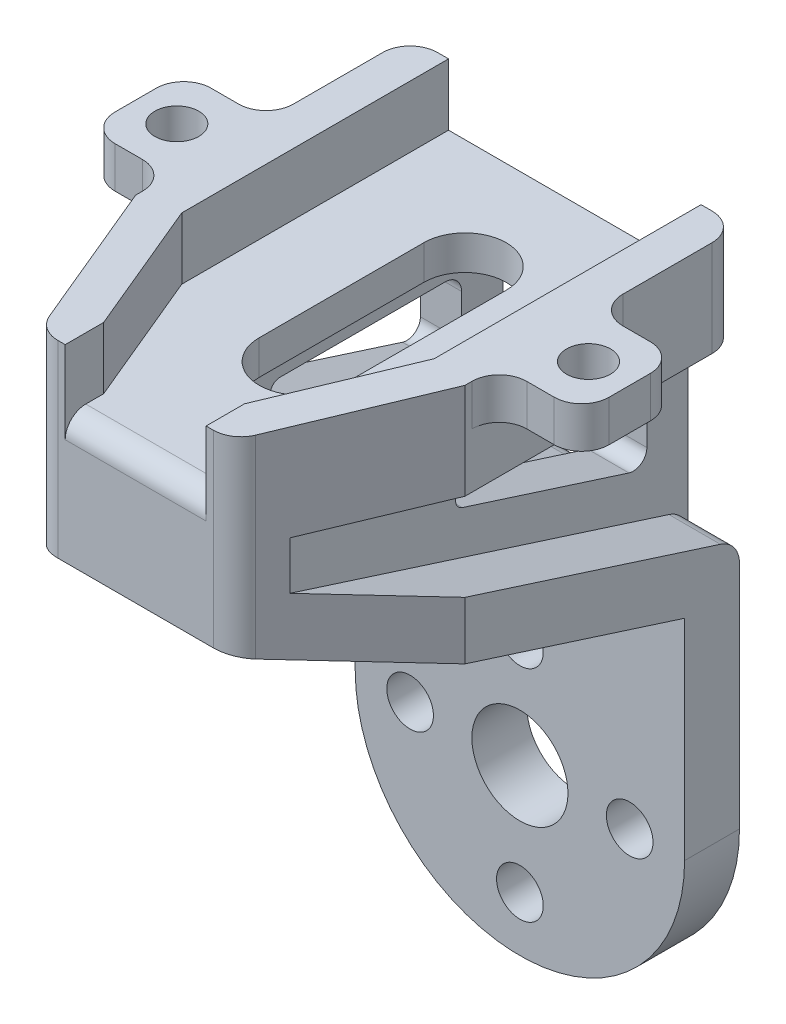
from build123d import *

# Parameters (mm, degrees)
EXTRUDE_1_DEPTH      = 3
SKETCH_7_R           = 1.75
SKETCH_7_R_2         = 2.25
CUT_EXTRUDE_2_DEPTH  = 143.955430949
CUT_EXTRUDE_4_DEPTH  = 3
CUT_EXTRUDE_5_DEPTH  = 3
CUT_EXTRUDE_8_DEPTH  = 3
SKETCH_12_R          = 1.7
CUT_EXTRUDE_9_DEPTH  = 3
SKETCH_13_R          = 1.7
CUT_EXTRUDE_11_DEPTH = 3
CUT_EXTRUDE_12_DEPTH = 143.955430949
FILLET_1_R           = 2
FILLET_2_R           = 2
CUT_EXTRUDE_13_DEPTH = 143.955430949
CUT_EXTRUDE_15_DEPTH = 143.955430949
CUT_EXTRUDE_16_DEPTH = 143.955430949
SKETCH_20_W          = 133.80338819
SKETCH_20_H          = 42.989432067
EXTRUDE_2_DEPTH      = 3
SKETCH_21_W          = 129.207272524
SKETCH_21_H          = 38.788932745
EXTRUDE_3_DEPTH      = 3
SKETCH_22_W          = 20.868569364
SKETCH_22_H          = 31.210515244
SKETCH_22_W_2        = 21.053246969
SKETCH_22_H_2        = 30.102449614
EXTRUDE_4_DEPTH      = 3
SKETCH_24_W          = 36.300662223
SKETCH_24_H          = 5.953308604
SKETCH_24_W_2        = 36.591067521
EXTRUDE_5_DEPTH      = 3
CUT_EXTRUDE_17_DEPTH = 143.955430949
CUT_EXTRUDE_19_DEPTH = 143.955430949
CUT_EXTRUDE_20_DEPTH = 143.955430949
CUT_EXTRUDE_21_DEPTH = 143.955430949
CUT_EXTRUDE_22_DEPTH = 143.955430949
CUT_EXTRUDE_23_DEPTH = 3
SKETCH_30_R          = 1.7
SKETCH_30_R_2        = 3.5
EXTRUDE_6_DEPTH      = 4
EXTRUDE_7_DEPTH      = 24
CUT_EXTRUDE_26_DEPTH = 31.5
EXTRUDE_8_DEPTH      = 10
EXTRUDE_9_DEPTH      = 1
CUT_EXTRUDE_27_DEPTH = 10
SKETCH_38_W          = 3
SKETCH_38_H          = 1
CUT_EXTRUDE_28_DEPTH = 166.273761152
CUT_EXTRUDE_29_DEPTH = 21
EXTRUDE_11_DEPTH     = 7
CUT_EXTRUDE_30_DEPTH = 5.5
EXTRUDE_12_DEPTH     = 3
CUT_EXTRUDE_31_DEPTH = 23
FILLET_4_R           = 0.7
FILLET_5_R           = 1
FILLET_6_R           = 1.2
CUT_EXTRUDE_32_DEPTH = 3
SKETCH_47_W          = 24
SKETCH_47_H          = 1
CUT_EXTRUDE_33_DEPTH = 167.672697425
SKETCH_48_W          = 6
SKETCH_48_H          = 7
SKETCH_48_R          = 1.6
EXTRUDE_13_DEPTH     = 3
FILLET_7_R           = 2
SKETCH_49_W          = 40.518885993
SKETCH_49_H          = 45.885701136
CUT_EXTRUDE_34_DEPTH = 33
FILLET_8_R           = 2
FILLET_9_R           = 2
FILLET_10_R          = 2
FILLET_11_R          = 2
FILLET_12_R          = 1.5
FILLET_13_R          = 1.5
SKETCH_51_W          = 39.862092077
SKETCH_51_H          = 12.943026848
CUT_EXTRUDE_36_DEPTH = 40


# Read off the part's stored shape, not the designer's step: 切除-拉伸35
with BuildPart() as part:
    # 草图1 → 凸台-拉伸1 (new body)
    # profile 1 of 14: a face of its own
    with BuildSketch(Plane.XY):
        with BuildLine():
            Line((60, 106.603296002), (35.889163634, 121.664519159))
            Line((35.889163634, 121.664519159), (-35.889163634, 121.664519159))
            Line((-35.889163634, 121.664519159), (-60, 106.603296002))
            Line((-60, 106.603296002), (-60, 94.801892265))
            Line((-60, 94.801892265), (-45, 94.801892265))
            ThreePointArc((-45, 94.801892265), (-43.762563133, 94.289329132), (-43.25, 93.051892265))
            Line((-43.25, 93.051892265), (-37.75, 93.051892265))
            ThreePointArc((-37.75, 93.051892265), (-37.237436867, 94.289329132), (-36, 94.801892265))
            Line((-36, 94.801892265), (-21, 94.801892265))
            ThreePointArc((-21, 94.801892265), (-19.762563133, 94.289329132), (-19.25, 93.051892265))
            Line((-19.25, 93.051892265), (19.25, 93.051892265))
            ThreePointArc((19.25, 93.051892265), (19.762563133, 94.289329132), (21, 94.801892265))
            Line((21, 94.801892265), (36, 94.801892265))
            ThreePointArc((36, 94.801892265), (37.237436867, 94.289329132), (37.75, 93.051892265))
            Line((37.75, 93.051892265), (43.25, 93.051892265))
            ThreePointArc((43.25, 93.051892265), (43.762563133, 94.289329132), (45, 94.801892265))
            Line((45, 94.801892265), (60, 94.801892265))
            Line((60, 94.801892265), (60, 106.603296002))
        make_face()
    # profile 2 of 14: a face of its own
    with BuildSketch(Plane.XY):
        with BuildLine():
            Line((66.901694095, 102.292041372), (60, 106.603296002))
            Line((60, 106.603296002), (60, 94.801892265))
            ThreePointArc((60, 94.801892265), (61.237436867, 94.289329132), (61.75, 93.051892265))
            Line((61.75, 93.051892265), (66.901694095, 93.051892265))
            Line((66.901694095, 93.051892265), (66.901694095, 102.292041372))
        make_face()
    # profile 3 of 14: a face of its own
    with BuildSketch(Plane.XY):
        with BuildLine():
            Line((-60, 94.801892265), (-60, 106.603296002))
            Line((-60, 106.603296002), (-66.901694095, 102.292041372))
            Line((-66.901694095, 102.292041372), (-66.901694095, 93.051892265))
            Line((-66.901694095, 93.051892265), (-61.75, 93.051892265))
            ThreePointArc((-61.75, 93.051892265), (-61.237436867, 94.289329132), (-60, 94.801892265))
        make_face()
    # profile 4 of 14: a face of its own
    with BuildSketch(Plane.XY):
        with BuildLine():
            Line((66.901694095, 63.051892265), (66.901694095, 93.051892265))
            Line((66.901694095, 93.051892265), (61.75, 93.051892265))
            ThreePointArc((61.75, 93.051892265), (61.237436867, 91.814455398), (60, 91.301892265))
            Line((60, 91.301892265), (60, 64.801892265))
            ThreePointArc((60, 64.801892265), (61.237436867, 64.289329132), (61.75, 63.051892265))
            Line((61.75, 63.051892265), (66.901694095, 63.051892265))
        make_face()
    # profile 5 of 14: a face of its own
    with BuildSketch(Plane.XY):
        with BuildLine():
            Line((-61.75, 93.051892265), (-66.901694095, 93.051892265))
            Line((-66.901694095, 93.051892265), (-66.901694095, 63.051892265))
            Line((-66.901694095, 63.051892265), (-61.75, 63.051892265))
            ThreePointArc((-61.75, 63.051892265), (-61.237436867, 64.289329132), (-60, 64.801892265))
            Line((-60, 64.801892265), (-60, 91.301892265))
            ThreePointArc((-60, 91.301892265), (-61.237436867, 91.814455398), (-61.75, 93.051892265))
        make_face()
    # profile 6 of 14: a face of its own
    with BuildSketch(Plane.XY):
        with BuildLine():
            Line((66.901694095, 52.870133869), (66.901694095, 63.051892265))
            Line((66.901694095, 63.051892265), (61.75, 63.051892265))
            ThreePointArc((61.75, 63.051892265), (61.237436867, 61.814455398), (60, 61.301892265))
            Line((60, 61.301892265), (60, 31.261343001))
            Line((60, 31.261343001), (75, 31.261343001))
            Line((75, 31.261343001), (75, 40.933889795))
            ThreePointArc((75, 40.933889795), (69.117351927, 45.658052319), (66.901694095, 52.870133869))
        make_face()
    # profile 7 of 14: a face of its own
    with BuildSketch(Plane.XY):
        with BuildLine():
            Line((60, 64.801892265), (60, 91.301892265))
            Line((60, 91.301892265), (45, 91.301892265))
            ThreePointArc((45, 91.301892265), (43.762563133, 91.814455398), (43.25, 93.051892265))
            Line((43.25, 93.051892265), (37.75, 93.051892265))
            ThreePointArc((37.75, 93.051892265), (37.237436867, 91.814455398), (36, 91.301892265))
            Line((36, 91.301892265), (21, 91.301892265))
            ThreePointArc((21, 91.301892265), (19.762563133, 91.814455398), (19.25, 93.051892265))
            Line((19.25, 93.051892265), (-19.25, 93.051892265))
            ThreePointArc((-19.25, 93.051892265), (-19.762563133, 91.814455398), (-21, 91.301892265))
            Line((-21, 91.301892265), (-36, 91.301892265))
            ThreePointArc((-36, 91.301892265), (-37.237436867, 91.814455398), (-37.75, 93.051892265))
            Line((-37.75, 93.051892265), (-43.25, 93.051892265))
            ThreePointArc((-43.25, 93.051892265), (-43.762563133, 91.814455398), (-45, 91.301892265))
            Line((-45, 91.301892265), (-60, 91.301892265))
            Line((-60, 91.301892265), (-60, 64.801892265))
            Line((-60, 64.801892265), (-45, 64.801892265))
            ThreePointArc((-45, 64.801892265), (-43.762563133, 64.289329132), (-43.25, 63.051892265))
            Line((-43.25, 63.051892265), (-37.75, 63.051892265))
            ThreePointArc((-37.75, 63.051892265), (-37.237436867, 64.289329132), (-36, 64.801892265))
            Line((-36, 64.801892265), (-21, 64.801892265))
            ThreePointArc((-21, 64.801892265), (-19.762563133, 64.289329132), (-19.25, 63.051892265))
            Line((-19.25, 63.051892265), (19.25, 63.051892265))
            ThreePointArc((19.25, 63.051892265), (19.762563133, 64.289329132), (21, 64.801892265))
            Line((21, 64.801892265), (36, 64.801892265))
            ThreePointArc((36, 64.801892265), (37.237436867, 64.289329132), (37.75, 63.051892265))
            Line((37.75, 63.051892265), (43.25, 63.051892265))
            ThreePointArc((43.25, 63.051892265), (43.762563133, 64.289329132), (45, 64.801892265))
            Line((45, 64.801892265), (60, 64.801892265))
        make_face()
    # profile 8 of 14: a face of its own
    with BuildSketch(Plane.XY):
        with BuildLine():
            Line((-61.75, 63.051892265), (-66.901694095, 63.051892265))
            Line((-66.901694095, 63.051892265), (-66.901694095, 52.870133869))
            ThreePointArc((-66.901694095, 52.870133869), (-69.117351927, 45.658052319), (-75, 40.933889795))
            Line((-75, 40.933889795), (-75, 31.261343001))
            Line((-75, 31.261343001), (-60, 31.261343001))
            Line((-60, 31.261343001), (-60, 61.301892265))
            ThreePointArc((-60, 61.301892265), (-61.237436867, 61.814455398), (-61.75, 63.051892265))
        make_face()
    # profile 9 of 14: a face of its own
    with BuildSketch(Plane.XY):
        with BuildLine():
            Line((60, 31.261343001), (60, 61.301892265))
            Line((60, 61.301892265), (45, 61.301892265))
            ThreePointArc((45, 61.301892265), (43.762563133, 61.814455398), (43.25, 63.051892265))
            Line((43.25, 63.051892265), (37.75, 63.051892265))
            ThreePointArc((37.75, 63.051892265), (37.237436867, 61.814455398), (36, 61.301892265))
            Line((36, 61.301892265), (21, 61.301892265))
            ThreePointArc((21, 61.301892265), (19.762563133, 61.814455398), (19.25, 63.051892265))
            Line((19.25, 63.051892265), (-19.25, 63.051892265))
            ThreePointArc((-19.25, 63.051892265), (-19.762563133, 61.814455398), (-21, 61.301892265))
            Line((-21, 61.301892265), (-36, 61.301892265))
            ThreePointArc((-36, 61.301892265), (-37.237436867, 61.814455398), (-37.75, 63.051892265))
            Line((-37.75, 63.051892265), (-43.25, 63.051892265))
            ThreePointArc((-43.25, 63.051892265), (-43.762563133, 61.814455398), (-45, 61.301892265))
            Line((-45, 61.301892265), (-60, 61.301892265))
            Line((-60, 61.301892265), (-60, 31.261343001))
            Line((-60, 31.261343001), (60, 31.261343001))
        make_face()
    # profile 10 of 14: a face of its own
    with BuildSketch(Plane.XY):
        with BuildLine():
            Line((60, -58.312864289), (60, 23.940028391))
            Line((60, 23.940028391), (-60, 23.940028391))
            Line((-60, 23.940028391), (-60, -58.312864289))
            Line((-60, -58.312864289), (-45, -58.312864289))
            ThreePointArc((-45, -58.312864289), (-43.25, -60.062864289), (-45, -61.812864289))
            Line((-45, -61.812864289), (-60, -61.812864289))
            Line((-60, -61.812864289), (-60, -88.312864289))
            Line((-60, -88.312864289), (-45, -88.312864289))
            ThreePointArc((-45, -88.312864289), (-43.25, -90.062864289), (-45, -91.812864289))
            Line((-45, -91.812864289), (-60, -91.812864289))
            Line((-60, -91.812864289), (-60, -111.849967256))
            Line((-60, -111.849967256), (-38.845469114, -105.590576733))
            ThreePointArc((-38.845469114, -105.590576733), (-36.037784492, -104.975210108), (-33.17088573, -104.768665882))
            Line((-33.17088573, -104.768665882), (33.17088573, -104.768665882))
            ThreePointArc((33.17088573, -104.768665882), (36.037784492, -104.975210108), (38.845469114, -105.590576733))
            Line((38.845469114, -105.590576733), (60, -111.849967256))
            Line((60, -111.849967256), (60, -91.812864289))
            Line((60, -91.812864289), (45, -91.812864289))
            ThreePointArc((45, -91.812864289), (43.762563133, -91.300301156), (43.25, -90.062864289))
            ThreePointArc((43.25, -90.062864289), (43.762563133, -88.825427422), (45, -88.312864289))
            Line((45, -88.312864289), (60, -88.312864289))
            Line((60, -88.312864289), (60, -61.812864289))
            Line((60, -61.812864289), (45, -61.812864289))
            ThreePointArc((45, -61.812864289), (43.762563133, -61.300301156), (43.25, -60.062864289))
            ThreePointArc((43.25, -60.062864289), (43.762563133, -58.825427422), (45, -58.312864289))
            Line((45, -58.312864289), (60, -58.312864289))
        make_face()
        with BuildLine():
            ThreePointArc((-21, -88.312864289), (-19.762563133, -88.825427422), (-19.25, -90.062864289))
            ThreePointArc((-19.25, -90.062864289), (-19.762563133, -91.300301156), (-21, -91.812864289))
            Line((-21, -91.812864289), (-36, -91.812864289))
            ThreePointArc((-36, -91.812864289), (-37.75, -90.062864289), (-36, -88.312864289))
            Line((-36, -88.312864289), (-21, -88.312864289))
        make_face(mode=Mode.SUBTRACT)
        with BuildLine():
            ThreePointArc((-21, -58.312864289), (-19.762563133, -58.825427422), (-19.25, -60.062864289))
            ThreePointArc((-19.25, -60.062864289), (-19.762563133, -61.300301156), (-21, -61.812864289))
            Line((-21, -61.812864289), (-36, -61.812864289))
            ThreePointArc((-36, -61.812864289), (-37.75, -60.062864289), (-36, -58.312864289))
            Line((-36, -58.312864289), (-21, -58.312864289))
        make_face(mode=Mode.SUBTRACT)
        with BuildLine():
            ThreePointArc((36, -88.312864289), (37.237436867, -88.825427422), (37.75, -90.062864289))
            ThreePointArc((37.75, -90.062864289), (37.237436867, -91.300301156), (36, -91.812864289))
            Line((36, -91.812864289), (21, -91.812864289))
            ThreePointArc((21, -91.812864289), (19.762563133, -91.300301156), (19.25, -90.062864289))
            ThreePointArc((19.25, -90.062864289), (19.762563133, -88.825427422), (21, -88.312864289))
            Line((21, -88.312864289), (36, -88.312864289))
        make_face(mode=Mode.SUBTRACT)
        with BuildLine():
            ThreePointArc((36, -58.312864289), (37.237436867, -58.825427422), (37.75, -60.062864289))
            ThreePointArc((37.75, -60.062864289), (37.237436867, -61.300301156), (36, -61.812864289))
            Line((36, -61.812864289), (21, -61.812864289))
            ThreePointArc((21, -61.812864289), (19.762563133, -61.300301156), (19.25, -60.062864289))
            ThreePointArc((19.25, -60.062864289), (19.762563133, -58.825427422), (21, -58.312864289))
            Line((21, -58.312864289), (36, -58.312864289))
        make_face(mode=Mode.SUBTRACT)
    # profile 11 of 14: a face of its own
    with BuildSketch(Plane.XY):
        with BuildLine():
            Line((75, 23.940028391), (60, 23.940028391))
            Line((60, 23.940028391), (60, -58.312864289))
            ThreePointArc((60, -58.312864289), (61.237436867, -58.825427422), (61.75, -60.062864289))
            Line((61.75, -60.062864289), (67.402721334, -60.062864289))
            add(Edge.make_bspline(
                [(75, 10.562559835), (72.695878257, 1.907314233), (70.339582535, -13.372796253), (67.818206704, -36.939032951), (67.208860388, -51.77269444), (67.402721334, -60.062864289)],
                knots=[0, 0, 0, 0, 0.235246678, 0.40629419, 0.624108181, 0.624108181, 0.624108181, 0.624108181], degree=3))
            Line((75, 10.562559835), (75, 23.940028391))
        make_face()
    # profile 12 of 14: a face of its own
    with BuildSketch(Plane.XY):
        with BuildLine():
            Line((-60, -58.312864289), (-60, 23.940028391))
            Line((-60, 23.940028391), (-75, 23.940028391))
            Line((-75, 23.940028391), (-75, 10.562559835))
            add(Edge.make_bspline(
                [(-75, 10.562559835), (-72.695878257, 1.907314233), (-70.339582535, -13.372796253), (-67.818206704, -36.939032951), (-67.208860388, -51.77269444), (-67.402721334, -60.062864289)],
                knots=[0, 0, 0, 0, 0.235246678, 0.40629419, 0.624108181, 0.624108181, 0.624108181, 0.624108181], degree=3))
            add(Edge.make_bspline(
                [(-67.402721334, -60.062864289), (-67.560325872, -66.802583754), (-68.323504015, -76.843670093), (-70.154131955, -86.778530076), (-70.533712858, -90.062864289)],
                knots=[0.624108181, 0.624108181, 0.624108181, 0.624108181, 0.801186001, 0.888408652, 0.888408652, 0.888408652, 0.888408652], degree=3))
            add(Edge.make_bspline(
                [(-70.533712858, -90.062864289), (-71.019342956, -94.264792095), (-71.137422935, -98.476048206), (-70.1742624, -102.732794059)],
                knots=[0.888408652, 0.888408652, 0.888408652, 0.888408652, 1, 1, 1, 1], degree=3))
            Line((-70.1742624, -102.732794059), (-66.460817635, -113.761651372))
            Line((-66.460817635, -113.761651372), (-60, -111.849967256))
            Line((-60, -111.849967256), (-60, -91.812864289))
            ThreePointArc((-60, -91.812864289), (-61.75, -90.062864289), (-60, -88.312864289))
            Line((-60, -88.312864289), (-60, -61.812864289))
            ThreePointArc((-60, -61.812864289), (-61.75, -60.062864289), (-60, -58.312864289))
        make_face()
    # profile 13 of 14: a face of its own
    with BuildSketch(Plane.XY):
        with BuildLine():
            Line((67.402721334, -60.062864289), (61.75, -60.062864289))
            ThreePointArc((61.75, -60.062864289), (61.237436867, -61.300301156), (60, -61.812864289))
            Line((60, -61.812864289), (60, -88.312864289))
            ThreePointArc((60, -88.312864289), (61.237436867, -88.825427422), (61.75, -90.062864289))
            Line((61.75, -90.062864289), (70.533712858, -90.062864289))
            add(Edge.make_bspline(
                [(67.402721334, -60.062864289), (67.560325872, -66.802583754), (68.323504015, -76.843670093), (70.154131955, -86.778530076), (70.533712858, -90.062864289)],
                knots=[0.624108181, 0.624108181, 0.624108181, 0.624108181, 0.801186001, 0.888408652, 0.888408652, 0.888408652, 0.888408652], degree=3))
        make_face()
    # profile 14 of 14: a face of its own
    with BuildSketch(Plane.XY):
        with BuildLine():
            add(Edge.make_bspline(
                [(70.533712858, -90.062864289), (71.019342956, -94.264792095), (71.137422935, -98.476048206), (70.1742624, -102.732794059)],
                knots=[0.888408652, 0.888408652, 0.888408652, 0.888408652, 1, 1, 1, 1], degree=3))
            Line((70.533712858, -90.062864289), (61.75, -90.062864289))
            ThreePointArc((61.75, -90.062864289), (61.237436867, -91.300301156), (60, -91.812864289))
            Line((60, -91.812864289), (60, -111.849967256))
            Line((60, -111.849967256), (66.460817635, -113.761651372))
            Line((66.460817635, -113.761651372), (70.1742624, -102.732794059))
        make_face()
    extrude(amount=EXTRUDE_1_DEPTH)

    # 草图7 → 切除-拉伸2 (cut, through all)
    with BuildSketch(Plane(origin=(0, 0, 0), x_dir=(-1, 0, 0), z_dir=(0, 0, -1))):
        with Locations((-21, 41.261343001)):
            Circle(SKETCH_7_R)
        with Locations((21, 41.261343001)):
            Circle(SKETCH_7_R)
        with Locations((-21, 13.940028391)):
            Circle(SKETCH_7_R_2)
        with Locations((21, 13.940028391)):
            Circle(SKETCH_7_R_2)
    extrude(amount=-CUT_EXTRUDE_2_DEPTH, mode=Mode.SUBTRACT)

    # 草图9 → 切除-拉伸4 (cut)
    with BuildSketch(Plane.XY.offset(3)):
        with BuildLine():
            Line((55, -100.49704609), (20, -100.49704609))
            ThreePointArc((20, -100.49704609), (18.25, -98.74704609), (20, -96.99704609))
            Line((20, -96.99704609), (55, -96.99704609))
            ThreePointArc((55, -96.99704609), (56.75, -98.74704609), (55, -100.49704609))
        make_face()
        with BuildLine():
            Line((-55, -96.99704609), (-20, -96.99704609))
            ThreePointArc((-20, -96.99704609), (-18.25, -98.74704609), (-20, -100.49704609))
            Line((-20, -100.49704609), (-55, -100.49704609))
            ThreePointArc((-55, -100.49704609), (-56.75, -98.74704609), (-55, -96.99704609))
        make_face()
    extrude(amount=-CUT_EXTRUDE_4_DEPTH, mode=Mode.SUBTRACT)

    # 草图10 → 切除-拉伸5 (cut)
    with BuildSketch(Plane.XY.offset(3)):
        with BuildLine():
            Line((12.5, -80.062864289), (-12.5, -80.062864289))
            ThreePointArc((-12.5, -80.062864289), (-17.5, -75.062864289), (-12.5, -70.062864289))
            Line((-12.5, -70.062864289), (12.5, -70.062864289))
            ThreePointArc((12.5, -70.062864289), (17.5, -75.062864289), (12.5, -80.062864289))
        make_face()
    extrude(amount=-CUT_EXTRUDE_5_DEPTH, mode=Mode.SUBTRACT)

    # 草图11 → 切除-拉伸8 (cut)
    with BuildSketch(Plane.XY.offset(3)):
        with BuildLine():
            Line((15, 73.051892265), (-15, 73.051892265))
            ThreePointArc((-15, 73.051892265), (-20, 78.051892265), (-15, 83.051892265))
            Line((-15, 83.051892265), (15, 83.051892265))
            ThreePointArc((15, 83.051892265), (20, 78.051892265), (15, 73.051892265))
        make_face()
    extrude(amount=-CUT_EXTRUDE_8_DEPTH, mode=Mode.SUBTRACT)

    # 草图12 → 切除-拉伸9 (cut)
    with BuildSketch(Plane.XY.offset(3)):
        with Locations((0, 114.371786435)):
            Circle(SKETCH_12_R)
        with Locations((0, 98.371786435)):
            Circle(SKETCH_12_R)
        with Locations((8, 106.371786435)):
            Circle(SKETCH_12_R)
        with Locations((-8, 106.371786435)):
            Circle(SKETCH_12_R)
    extrude(amount=-CUT_EXTRUDE_9_DEPTH, mode=Mode.SUBTRACT)

    # 草图13 → 切除-拉伸11 (cut)
    with BuildSketch(Plane.XY.offset(3)):
        with Locations((0, -84.415765086)):
            Circle(SKETCH_13_R)
        with Locations((8, -92.415765086)):
            Circle(SKETCH_13_R)
        with Locations((0, -100.415765086)):
            Circle(SKETCH_13_R)
        with Locations((-8, -92.415765086)):
            Circle(SKETCH_13_R)
    extrude(amount=-CUT_EXTRUDE_11_DEPTH, mode=Mode.SUBTRACT)

    # 草图14 → 切除-拉伸12 (cut, through all)
    with BuildSketch(Plane.XY.offset(3)):
        with BuildLine():
            Line((-55.475501567, 8.919687236), (-55.475501567, -46.080312764))
            ThreePointArc((-55.475501567, -46.080312764), (-57.225501567, -47.830312764), (-58.975501567, -46.080312764))
            Line((-58.975501567, -46.080312764), (-58.975501567, 8.919687236))
            ThreePointArc((-58.975501567, 8.919687236), (-57.225501567, 10.669687236), (-55.475501567, 8.919687236))
        make_face()
        with BuildLine():
            Line((58.975501567, 8.919687236), (58.975501567, -46.080312764))
            ThreePointArc((58.975501567, -46.080312764), (57.225501567, -47.830312764), (55.475501567, -46.080312764))
            Line((55.475501567, -46.080312764), (55.475501567, 8.919687236))
            ThreePointArc((55.475501567, 8.919687236), (57.225501567, 10.669687236), (58.975501567, 8.919687236))
        make_face()
    extrude(amount=-CUT_EXTRUDE_12_DEPTH, mode=Mode.SUBTRACT)

    # 圆角1
    fillet_1_edges = [part.edges().sort_by_distance(p)[0] for p in [
        (75, 31.261343001, 1.5),
        (-75, 31.261343001, 1.5),
    ]]
    fillet(fillet_1_edges, radius=FILLET_1_R)

    # 圆角2
    fillet_2_edges = [part.edges().sort_by_distance(p)[0] for p in [
        (-75, 23.940028391, 1.5),
        (75, 23.940028391, 1.5),
    ]]
    fillet(fillet_2_edges, radius=FILLET_2_R)

    # 草图15 → 切除-拉伸13 (cut, through all)
    with BuildSketch(Plane(origin=(0, 0, 0), x_dir=(-1, 0, 0), z_dir=(0, 0, -1))):
        with BuildLine():
            Line((-61.184216401, 102.403501276), (-34.774762862, 118.900592756))
            ThreePointArc((-34.774762862, 118.900592756), (-32.70788159, 118.423097411), (-33.185376934, 116.356216138))
            Line((-33.185376934, 116.356216138), (-59.594830473, 99.859124658))
            ThreePointArc((-59.594830473, 99.859124658), (-61.661711746, 100.336620003), (-61.184216401, 102.403501276))
        make_face()
        with BuildLine():
            Line((59.594830473, 99.859124658), (33.185376934, 116.356216138))
            ThreePointArc((33.185376934, 116.356216138), (32.70788159, 118.423097411), (34.774762862, 118.900592756))
            Line((34.774762862, 118.900592756), (61.184216401, 102.403501276))
            ThreePointArc((61.184216401, 102.403501276), (61.661711746, 100.336620003), (59.594830473, 99.859124658))
        make_face()
    extrude(amount=-CUT_EXTRUDE_13_DEPTH, mode=Mode.SUBTRACT)

    # 草图17 → 切除-拉伸15 (cut, through all)
    with BuildSketch(Plane(origin=(0, 0, 0), x_dir=(-1, 0, 0), z_dir=(0, 0, -1))):
        Polygon((-28.645414283, -8.118433382), (-34.644957411, -20.11751964), (-34.644957411, -29.946558382), (-37.580904049, -29.946558382), (-37.580904049, -20.11751964), (-43.580447177, -8.118433382), (-40.64450054, -8.118433382), (-36.176755657, -17.43687271), (-36.049105803, -17.43687271), (-31.58136092, -8.118433382), align=None)
    extrude(amount=-CUT_EXTRUDE_15_DEPTH, mode=Mode.SUBTRACT)

    # 草图18 → 切除-拉伸16 (cut, through all)
    with BuildSketch(Plane(origin=(0, 0, 0), x_dir=(-1, 0, 0), z_dir=(0, 0, -1))):
        Polygon((46.06697123, -29.087529791), (43.131024593, -29.087529791), (43.131024593, -18.875541487), (35.854982926, -18.875541487), (35.854982926, -29.087529791), (32.919036289, -29.087529791), (32.919036289, -7.259404791), (35.854982926, -7.259404791), (35.854982926, -16.450194265), (43.131024593, -16.450194265), (43.131024593, -7.259404791), (46.06697123, -7.259404791), align=None)
    extrude(amount=-CUT_EXTRUDE_16_DEPTH, mode=Mode.SUBTRACT)

    # 草图20 → 凸台-拉伸2 (add)
    with BuildSketch(Plane(origin=(0, 0, 0), x_dir=(-1, 0, 0), z_dir=(0, 0, -1))):
        with Locations((0, 74.364849902)):
            Rectangle(SKETCH_20_W, SKETCH_20_H)
    extrude(amount=-EXTRUDE_2_DEPTH)

    # 草图21 → 凸台-拉伸3 (add)
    with BuildSketch(Plane(origin=(0, 0, 0), x_dir=(-1, 0, 0), z_dir=(0, 0, -1))):
        with Locations((-0.162688936, -75.817262983)):
            Rectangle(SKETCH_21_W, SKETCH_21_H)
    extrude(amount=-EXTRUDE_3_DEPTH)

    # 草图22 → 凸台-拉伸4 (add)
    with BuildSketch(Plane(origin=(0, 0, 0), x_dir=(-1, 0, 0), z_dir=(0, 0, -1))):
        with Locations((-36.28455521, -18.718035035)):
            Rectangle(SKETCH_22_W, SKETCH_22_H)
        with Locations((39.340924035, -18.16400222)):
            Rectangle(SKETCH_22_W_2, SKETCH_22_H_2)
    extrude(amount=-EXTRUDE_4_DEPTH)

    # 草图24 → 凸台-拉伸5 (add)
    with BuildSketch(Plane(origin=(0, 0, 0), x_dir=(-1, 0, 0), z_dir=(0, 0, -1))):
        with Locations((-46.84572901, 41.350914957)):
            Rectangle(SKETCH_24_W, SKETCH_24_H)
        with Locations((47.53599277, 41.350914957)):
            Rectangle(SKETCH_24_W_2, SKETCH_24_H)
    extrude(amount=-EXTRUDE_5_DEPTH)

    # 草图25 → 切除-拉伸17 (cut, through all)
    with BuildSketch(Plane(origin=(0, 0, 0), x_dir=(-1, 0, 0), z_dir=(0, 0, -1))):
        with BuildLine():
            Line((-14.658238954, 113.011343001), (-32.658238954, 113.011343001))
            ThreePointArc((-32.658238954, 113.011343001), (-34.408238954, 111.261343001), (-32.658238954, 109.511343001))
            Line((-32.658238954, 109.511343001), (-14.658238954, 109.511343001))
            ThreePointArc((-14.658238954, 109.511343001), (-12.908238954, 111.261343001), (-14.658238954, 113.011343001))
        make_face()
        with BuildLine():
            Line((-20.999999982, 43.011343001), (-32.658238954, 43.011343001))
            ThreePointArc((-32.658238954, 43.011343001), (-34.408238954, 41.261343001), (-32.658238954, 39.511343001))
            Line((-32.658238954, 39.511343001), (-21, 39.511343001))
            ThreePointArc((-21, 39.511343001), (-22.75, 41.26134301), (-20.999999982, 43.011343001))
        make_face()
        with BuildLine():
            ThreePointArc((14.341761046, 113.011343001), (12.591761046, 111.261343001), (14.341761046, 109.511343001))
            Line((14.341761046, 109.511343001), (32.341761046, 109.511343001))
            ThreePointArc((32.341761046, 109.511343001), (34.091761046, 111.261343001), (32.341761046, 113.011343001))
            Line((32.341761046, 113.011343001), (14.341761046, 113.011343001))
        make_face()
        with BuildLine():
            Line((-14.658238954, 43.011343001), (-20.999999982, 43.011343001))
            ThreePointArc((-20.999999982, 43.011343001), (-19.25, 41.261342991), (-21, 39.511343001))
            Line((-21, 39.511343001), (-14.658238954, 39.511343001))
            ThreePointArc((-14.658238954, 39.511343001), (-12.908238954, 41.261343001), (-14.658238954, 43.011343001))
        make_face()
        with BuildLine():
            ThreePointArc((32.341761046, 39.511343001), (34.091761046, 41.261343001), (32.341761046, 43.011343001))
            Line((32.341761046, 43.011343001), (21, 43.011343001))
            ThreePointArc((21, 43.011343001), (22.75, 41.261343001), (21, 39.511343001))
            Line((21, 39.511343001), (32.341761046, 39.511343001))
        make_face()
        with BuildLine():
            ThreePointArc((14.341761046, 43.011343001), (12.591761046, 41.261343001), (14.341761046, 39.511343001))
            Line((14.341761046, 39.511343001), (21, 39.511343001))
            ThreePointArc((21, 39.511343001), (19.25, 41.261343001), (21, 43.011343001))
            Line((21, 43.011343001), (14.341761046, 43.011343001))
        make_face()
    extrude(amount=-CUT_EXTRUDE_17_DEPTH, mode=Mode.SUBTRACT)

    # 草图16 → 切除-拉伸19 (cut, through all)
    with BuildSketch(Plane(origin=(0, 0, 0), x_dir=(-1, 0, 0), z_dir=(0, 0, -1))):
        with BuildLine():
            Line((-62, 43.011343001), (-32, 43.011343001))
            ThreePointArc((-32, 43.011343001), (-30.25, 41.261343001), (-32, 39.511343001))
            Line((-32, 39.511343001), (-62, 39.511343001))
            ThreePointArc((-62, 39.511343001), (-63.75, 41.261343001), (-62, 43.011343001))
        make_face()
        with BuildLine():
            Line((62, 39.511343001), (32, 39.511343001))
            ThreePointArc((32, 39.511343001), (30.25, 41.261343001), (32, 43.011343001))
            Line((32, 43.011343001), (62, 43.011343001))
            ThreePointArc((62, 43.011343001), (63.75, 41.261343001), (62, 39.511343001))
        make_face()
    extrude(amount=-CUT_EXTRUDE_19_DEPTH, mode=Mode.SUBTRACT)

    # 草图26 → 切除-拉伸20 (cut, through all)
    with BuildSketch(Plane(origin=(0, 0, 0), x_dir=(-1, 0, 0), z_dir=(0, 0, -1))):
        with BuildLine():
            Line((15, 71.876956146), (-15, 71.876956146))
            ThreePointArc((-15, 71.876956146), (-20, 76.876956146), (-15, 81.876956146))
            Line((-15, 81.876956146), (15, 81.876956146))
            ThreePointArc((15, 81.876956146), (20, 76.876956146), (15, 71.876956146))
        make_face()
    extrude(amount=-CUT_EXTRUDE_20_DEPTH, mode=Mode.SUBTRACT)

    # 草图27 → 切除-拉伸21 (cut, through all)
    with BuildSketch(Plane(origin=(0, 0, 0), x_dir=(-1, 0, 0), z_dir=(0, 0, -1))):
        with BuildLine():
            Line((-10, -15.809971609), (-42.5, -15.809971609))
            ThreePointArc((-42.5, -15.809971609), (-44.25, -17.559971609), (-42.5, -19.309971609))
            Line((-42.5, -19.309971609), (-10, -19.309971609))
            ThreePointArc((-10, -19.309971609), (-8.25, -17.559971609), (-10, -15.809971609))
        make_face()
        with BuildLine():
            ThreePointArc((-42.5, 7.190028391), (-44.25, 5.440028391), (-42.5, 3.690028391))
            Line((-42.5, 3.690028391), (-10, 3.690028391))
            ThreePointArc((-10, 3.690028391), (-8.25, 5.440028391), (-10, 7.190028391))
            Line((-10, 7.190028391), (-42.5, 7.190028391))
        make_face()
        with BuildLine():
            Line((42.5, -15.809971609), (10, -15.809971609))
            ThreePointArc((10, -15.809971609), (8.25, -17.559971609), (10, -19.309971609))
            Line((10, -19.309971609), (42.5, -19.309971609))
            ThreePointArc((42.5, -19.309971609), (44.25, -17.559971609), (42.5, -15.809971609))
        make_face()
        with BuildLine():
            Line((42.5, 7.190028391), (10, 7.190028391))
            ThreePointArc((10, 7.190028391), (8.25, 5.440028391), (10, 3.690028391))
            Line((10, 3.690028391), (42.5, 3.690028391))
            ThreePointArc((42.5, 3.690028391), (44.25, 5.440028391), (42.5, 7.190028391))
        make_face()
    extrude(amount=-CUT_EXTRUDE_21_DEPTH, mode=Mode.SUBTRACT)

    # 草图28 → 切除-拉伸22 (cut, through all)
    with BuildSketch(Plane(origin=(0, 0, 0), x_dir=(-1, 0, 0), z_dir=(0, 0, -1))):
        with BuildLine():
            ThreePointArc((0, -48.812330529), (-7.86916468, -46.39674179), (-10.284753419, -54.26590647))
            ThreePointArc((-10.284753419, -54.26590647), (-5.977554294, -59.915955393), (0, -63.755729058))
            ThreePointArc((0, -63.755729058), (5.977554294, -59.915955393), (10.284753419, -54.26590647))
            ThreePointArc((10.284753419, -54.26590647), (7.86916468, -46.39674179), (0, -48.812330529))
        make_face()
    extrude(amount=-CUT_EXTRUDE_22_DEPTH, mode=Mode.SUBTRACT)

    # 草图29 → 切除-拉伸23 (cut)
    with BuildSketch(Plane(origin=(0, 0, 0), x_dir=(-1, 0, 0), z_dir=(0, 0, -1))):
        with BuildLine():
            ThreePointArc((-21.368709037, -73.490793052), (0, -84.713248851), (21.368709037, -73.490793052))
            ThreePointArc((21.368709037, -73.490793052), (23.760053677, -73.051240341), (24.199606389, -75.442584981))
            ThreePointArc((24.199606389, -75.442584981), (0, -88.151776376), (-24.199606389, -75.442584981))
            ThreePointArc((-24.199606389, -75.442584981), (-23.760053677, -73.051240341), (-21.368709037, -73.490793052))
        make_face()
    extrude(amount=-CUT_EXTRUDE_23_DEPTH, mode=Mode.SUBTRACT)


with BuildPart() as body_2:
    # 草图30 → 凸台-拉伸6 (new body)
    with BuildSketch(Plane(origin=(0, 0, -10), x_dir=(-1, 0, 0), z_dir=(0, 0, -1))):
        with BuildLine():
            Line((-12, 106.371786435), (-12, 141.664519159))
            Line((-12, 141.664519159), (12, 141.664519159))
            Line((12, 141.664519159), (12, 106.371786435))
            ThreePointArc((12, 106.371786435), (0, 94.371786435), (-12, 106.371786435))
        make_face()
        with Locations((8, 106.371786435)):
            Circle(SKETCH_30_R, mode=Mode.SUBTRACT)
        with Locations((0, 98.371786435)):
            Circle(SKETCH_30_R, mode=Mode.SUBTRACT)
        with Locations((-8, 106.371786435)):
            Circle(SKETCH_30_R, mode=Mode.SUBTRACT)
        with Locations((0, 114.371786435)):
            Circle(SKETCH_30_R, mode=Mode.SUBTRACT)
        with Locations((0, 106.371786435)):
            Circle(SKETCH_30_R_2, mode=Mode.SUBTRACT)
    extrude(amount=EXTRUDE_6_DEPTH)

    # 草图31 → 凸台-拉伸7 (add)
    with BuildSketch(Plane.ZY.offset(12)):
        Polygon((-10, 121.664519159), (15, 129.664519159), (18, 130.624519159), (18, 139.364328678), (15, 139.364328678), (15, 133.864328678), (-10, 125.864328678), align=None)
    extrude(amount=-EXTRUDE_7_DEPTH)

    # 草图32 → 切除-拉伸26 (cut)
    with BuildSketch(Plane.ZY.offset(12)):
        Polygon((-14, 124.584328678), (-10, 125.864328678), (-10, 141.664519159), (-14, 141.664519159), align=None)
    extrude(amount=-CUT_EXTRUDE_26_DEPTH, mode=Mode.SUBTRACT)

    # 草图34 → 凸台-拉伸8 (add)
    with BuildSketch(Plane(origin=(0, 139.364328678, 0), x_dir=(1, 0, 0), z_dir=(0, 1, 0))):
        Polygon((-12, -6), (-7, -18), (7, -18), (12, -6), (12, 14), (-12, 14), align=None)
    extrude(amount=EXTRUDE_8_DEPTH)

    # 草图36 → 凸台-拉伸9 (add)
    with BuildSketch(Plane(origin=(0, 137.364328678, 0), x_dir=(-1, 0, 0), z_dir=(0, -1, 0))):
        Polygon((-12, -6), (-8.25, -15), (8.25, -15), (12, -6), (12, 14), (-12, 14), align=None)
    extrude(amount=-EXTRUDE_9_DEPTH)

    # 草图37 → 切除-拉伸27 (cut)
    with BuildSketch(Plane(origin=(0, 149.364328678, 0), x_dir=(1, 0, 0), z_dir=(0, 1, 0))):
        Polygon((-12, 14), (-12, -6), (-7, -18), (7, -18), (12, -6), (12, 14), align=None)
    extrude(amount=-CUT_EXTRUDE_27_DEPTH, mode=Mode.SUBTRACT)

    # 草图38 → 切除-拉伸28 (cut, through all)
    with BuildSketch(Plane.ZY.offset(12)):
        with Locations((16.5, 138.864328678)):
            Rectangle(SKETCH_38_W, SKETCH_38_H)
    extrude(amount=-CUT_EXTRUDE_28_DEPTH, mode=Mode.SUBTRACT)

    # 草图39 → 切除-拉伸29 (cut)
    with BuildSketch(Plane(origin=(0, 138.364328678, 0), x_dir=(1, 0, 0), z_dir=(0, 1, 0))):
        Polygon((12, -6), (8.25, -15), (7, -18), (12, -18), align=None)
        Polygon((-8.25, -15), (-12, -6), (-12, -18), (-7, -18), align=None)
    extrude(amount=-CUT_EXTRUDE_29_DEPTH, mode=Mode.SUBTRACT)

    # 草图41 → 凸台-拉伸11 (add)
    with BuildSketch(Plane(origin=(0, 138.364328678, 0), x_dir=(1, 0, 0), z_dir=(0, 1, 0))):
        Polygon((-7, -18), (7, -18), (12, -6), (12, 14), (-12, 14), (-12, -6), align=None)
    extrude(amount=EXTRUDE_11_DEPTH)

    # 草图42 → 切除-拉伸30 (cut)
    with BuildSketch(Plane(origin=(0, 145.364328678, 0), x_dir=(1, 0, 0), z_dir=(0, 1, 0))):
        Polygon((-9.2, 14), (-9.2, 11.2), (-9.2, -5.44), (-5.133333333, -15.2), (-5.133333333, -18), (5.133333333, -18), (5.133333333, -15.2), (9.2, -5.44), (9.2, 11.2), (9.2, 14), align=None)
    extrude(amount=-CUT_EXTRUDE_30_DEPTH, mode=Mode.SUBTRACT)

    # 草图43 → 凸台-拉伸12 (add)
    with BuildSketch(Plane.ZY.offset(8.25)):
        Polygon((15, 137.364328678), (-14, 137.364328678), (-14, 124.584328678), (15, 133.864328678), align=None)
    extrude_12 = extrude(amount=-EXTRUDE_12_DEPTH)

    # 镜向1: 凸台-拉伸12 across plane
    add(extrude_12.mirror(Plane(origin=(0, 0, 0), x_dir=(0, 0, 1), z_dir=(1, 0, 0))))

    # 草图44 → 切除-拉伸31 (cut)
    with BuildSketch(Plane.ZY.offset(8.25)):
        Polygon((-11, 134.364328678), (6.719196439, 134.364328678), (-11, 128.694185818), align=None)
    extrude(amount=-CUT_EXTRUDE_31_DEPTH, mode=Mode.SUBTRACT)

    # 圆角4
    fillet_4_edges = [body_2.edges().sort_by_distance(p)[0] for p in [
        (-6.75, 134.364328678, 6.719196439),
        (6.75, 134.364328678, 6.719196439),
    ]]
    fillet(fillet_4_edges, radius=FILLET_4_R)

    # 圆角5
    fillet_5_edges = [body_2.edges().sort_by_distance(p)[0] for p in [
        (-6.75, 128.694185818, -11),
        (6.75, 128.694185818, -11),
    ]]
    fillet(fillet_5_edges, radius=FILLET_5_R)

    # 圆角6
    fillet_6_edges = [body_2.edges().sort_by_distance(p)[0] for p in [
        (-6.75, 134.364328678, -11),
        (6.75, 134.364328678, -11),
    ]]
    fillet(fillet_6_edges, radius=FILLET_6_R)

    # 草图45 → 切除-拉伸32 (cut)
    with BuildSketch(Plane(origin=(0, 139.864328678, 0), x_dir=(1, 0, 0), z_dir=(0, 1, 0))):
        with BuildLine():
            Line((3, -6), (3, 6))
            ThreePointArc((3, 6), (0, 9), (-3, 6))
            Line((-3, 6), (-3, -6))
            ThreePointArc((-3, -6), (0, -9), (3, -6))
        make_face()
    extrude(amount=-CUT_EXTRUDE_32_DEPTH, mode=Mode.SUBTRACT)

    # 草图47 → 切除-拉伸33 (cut, through all)
    with BuildSketch(Plane(origin=(0, 0, -14), x_dir=(-1, 0, 0), z_dir=(0, 0, -1))):
        with Locations((0, 144.864328678)):
            Rectangle(SKETCH_47_W, SKETCH_47_H)
    extrude(amount=-CUT_EXTRUDE_33_DEPTH, mode=Mode.SUBTRACT)

    # 草图48 → 凸台-拉伸13 (add)
    # profile 1 of 2: a face of its own
    with BuildSketch(Plane(origin=(0, 144.364328678, 0), x_dir=(1, 0, 0), z_dir=(0, 1, 0))):
        with Locations((-15, 0)):
            Rectangle(SKETCH_48_W, SKETCH_48_H)
        with Locations(Location((-15, 0, 0), (0, 0, 270))):
            Circle(SKETCH_48_R, mode=Mode.SUBTRACT)
    # profile 2 of 2: a face of its own
    with BuildSketch(Plane(origin=(0, 144.364328678, 0), x_dir=(1, 0, 0), z_dir=(0, 1, 0))):
        with Locations((15, 0)):
            Rectangle(SKETCH_48_W, SKETCH_48_H)
        with Locations(Location((15, 0, 0), (0, 0, 90))):
            Circle(SKETCH_48_R, mode=Mode.SUBTRACT)
    extrude(amount=-EXTRUDE_13_DEPTH)

    # 圆角7
    fillet_7_edges = [body_2.edges().sort_by_distance(p)[0] for p in [
        (-18, 142.864328678, 3.5),
        (-18, 142.864328678, -3.5),
        (-12, 142.864328678, -3.5),
        (-12, 142.864328678, 3.5),
        (18, 142.864328678, 3.5),
        (12, 142.864328678, 3.5),
        (12, 142.864328678, -3.5),
        (18, 142.864328678, -3.5),
    ]]
    fillet(fillet_7_edges, radius=FILLET_7_R)


with BuildPart() as body_3:
    # 镜向2: mirrored copy
    add(body_2.part.mirror(Plane.ZX.offset(148.364328678)))

    # 草图49 → 切除-拉伸34 (cut)
    with BuildSketch(Plane.ZY.offset(12)):
        with Locations((6.259442997, 182.307179246)):
            Rectangle(SKETCH_49_W, SKETCH_49_H)
    extrude(amount=-CUT_EXTRUDE_34_DEPTH, mode=Mode.SUBTRACT)

    # 圆角8
    fillet_8_edges = [body_3.edges().sort_by_distance(p)[0] for p in [
        (-12, 155.864328678, -14),
        (12, 155.864328678, -14),
        (7, 155.864328678, 18),
        (-7, 155.864328678, 18),
    ]]
    fillet(fillet_8_edges, radius=FILLET_8_R)

    # 圆角12
    fillet_12_edges = [body_3.edges().sort_by_distance(p)[0] for p in [
        (0, 156.864328678, 18),
    ]]
    fillet(fillet_12_edges, radius=FILLET_12_R)

    # 草图51 → 切除-拉伸36 (cut)
    with BuildSketch(Plane(origin=(0, 0, -14), x_dir=(-1, 0, 0), z_dir=(0, 0, -1))):
        with Locations((0.094618121, 157.061471558)):
            Rectangle(SKETCH_51_W, SKETCH_51_H)
    extrude(amount=-CUT_EXTRUDE_36_DEPTH, mode=Mode.SUBTRACT)


with BuildPart() as body_2_1:
    add(body_2.part)

    # 圆角9
    fillet_9_edges = [body_2_1.edges().sort_by_distance(p)[0] for p in [
        (7, 137.494423918, 18),
        (-7, 137.494423918, 18),
    ]]
    fillet(fillet_9_edges, radius=FILLET_9_R)

    # 圆角10
    fillet_10_edges = [body_2_1.edges().sort_by_distance(p)[0] for p in [
        (-12, 140.864328678, -14),
        (12, 140.864328678, -14),
    ]]
    fillet(fillet_10_edges, radius=FILLET_10_R)

    # 圆角11
    fillet_11_edges = [body_2_1.edges().sort_by_distance(p)[0] for p in [
        (-10.125, 124.584328678, -14),
        (0, 124.584328678, -14),
        (10.125, 124.584328678, -14),
    ]]
    fillet(fillet_11_edges, radius=FILLET_11_R)

    # 圆角13
    fillet_13_edges = [body_2_1.edges().sort_by_distance(p)[0] for p in [
        (0, 139.864328678, 18),
    ]]
    fillet(fillet_13_edges, radius=FILLET_13_R)


solid = body_2_1.part
